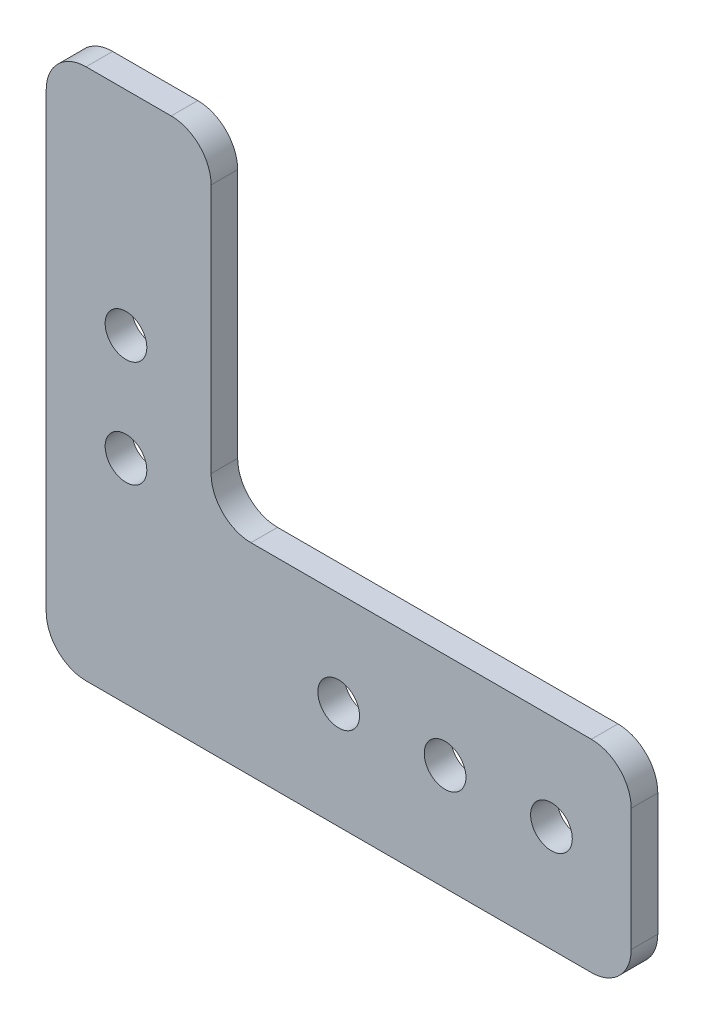
from build123d import *

# Parameters (mm, degrees)
SKETCH1_R           = 2.4892
BOSS_EXTRUDE1_DEPTH = 3.175
SKETCH2_W           = 4.445
SKETCH2_H           = 39.37
CUT_EXTRUDE1_DEPTH  = 48.306434552
FILLET1_R           = 4.7625


with BuildPart() as part:
    # Sketch1 → Boss-Extrude1 (new body)
    with BuildSketch(Plane.XY):
        Polygon((-34.925, 31.75), (-34.925, -31.75), (34.925, -31.75), (34.925, -7.62), (-10.795, -7.62), (-10.795, 31.75), align=None)
        with Locations((0, -19.05)):
            Circle(SKETCH1_R, mode=Mode.SUBTRACT)
        with Locations((-25.4, -6.35)):
            Circle(SKETCH1_R, mode=Mode.SUBTRACT)
        with Locations((12.7, -19.05)):
            Circle(SKETCH1_R, mode=Mode.SUBTRACT)
        with Locations((25.4, -19.05)):
            Circle(SKETCH1_R, mode=Mode.SUBTRACT)
        with Locations((-25.4, 6.35)):
            Circle(SKETCH1_R, mode=Mode.SUBTRACT)
    extrude(amount=BOSS_EXTRUDE1_DEPTH)

    # Sketch2 → Cut-Extrude1 (cut, through all)
    with BuildSketch(Plane.XY.offset(3.175)):
        with Locations((-13.0175, 12.065)):
            Rectangle(SKETCH2_W, SKETCH2_H)
    extrude(amount=-CUT_EXTRUDE1_DEPTH, mode=Mode.SUBTRACT)

    # Fillet1
    fillet1_edges = [part.edges().sort_by_distance(p)[0] for p in [
        (34.925, -7.62, 1.5875),
        (34.925, -31.75, 1.5875),
        (-34.925, 31.75, 1.5875),
        (-15.24, 31.75, 1.5875),
        (-15.24, -7.62, 1.5875),
        (-34.925, -31.75, 1.5875),
    ]]
    fillet(fillet1_edges, radius=FILLET1_R)


solid = part.part
